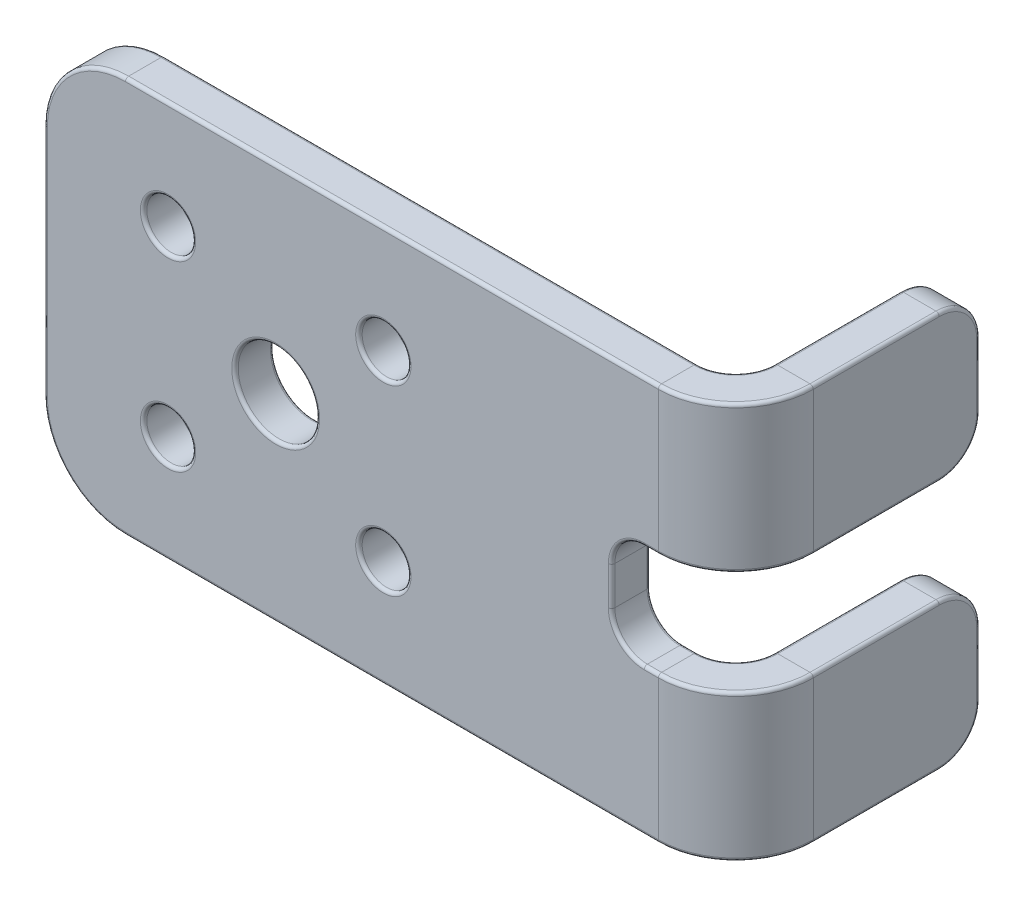
from build123d import *

# Parameters (mm, degrees)
BASE_FLANGE2_DEPTH             = 4.76
FILLET1_R                      = 4
FILLET2_R                      = 10
EDGE_FLANGE1_STRIP_W           = 28.56
EDGE_FLANGE1_STRIP_H           = 4.76
EDGE_FLANGE1_STRIP_CUT_DEPTH   = 18
EDGE_FLANGE1_STRIP_2_W         = 28.56
EDGE_FLANGE1_STRIP_2_H         = 4.76
EDGE_FLANGE1_STRIP_CUT_2_DEPTH = 18
EDGE_FLANGE1_DEPTH             = 18
EDGE_FLANGE1_BEND_DEPTH        = 18
FILLET3_R                      = 5
SKETCH16_R                     = 3
SKETCH16_R_2                   = 5
CUT_EXTRUDE2_DEPTH             = 10
FILLET4_R                      = 0.4
FILLET5_R                      = 0.4


# Sheet-metal steps are written as plain solids
with BuildPart() as part:
    # Sketch1 → Base-Flange2 (new body)
    with BuildSketch(Plane.XY):
        Polygon((27.240436749, 6.355), (42.5, 6.355), (42.5, 24.355), (-42.5, 24.355), (-42.5, -24.355), (42.5, -24.355), (42.5, -6.355), (27.240436749, -6.355), align=None)
    extrude(amount=-BASE_FLANGE2_DEPTH)

    # Fillet1
    fillet1_edges = [part.edges().sort_by_distance(p)[0] for p in [
        (27.240436749, 6.355, -2.38),
        (27.240436749, -6.355, -2.38),
    ]]
    fillet(fillet1_edges, radius=FILLET1_R)

    # Fillet2
    fillet2_edges = [part.edges().sort_by_distance(p)[0] for p in [
        (-42.5, -24.355, -2.38),
        (-42.5, 24.355, -2.38),
    ]]
    fillet(fillet2_edges, radius=FILLET2_R)

    # Edge-Flange1 strip (across the edge) → Edge-Flange1 strip cut (cut)
    with BuildSketch(Plane(origin=(42.5, 24.355, -4.76), x_dir=(-1, 0, 0), z_dir=(0, -1, 0))):
        with Locations((-4.76, -2.38)):
            Rectangle(EDGE_FLANGE1_STRIP_W, EDGE_FLANGE1_STRIP_H)
    extrude(amount=EDGE_FLANGE1_STRIP_CUT_DEPTH, mode=Mode.SUBTRACT)

    # Edge-Flange1 strip 2 (across the edge) → Edge-Flange1 strip cut 2 (cut)
    with BuildSketch(Plane(origin=(42.5, -6.355, -4.76), x_dir=(-1, 0, 0), z_dir=(0, -1, 0))):
        with Locations((-4.76, -2.38)):
            Rectangle(EDGE_FLANGE1_STRIP_2_W, EDGE_FLANGE1_STRIP_2_H)
    extrude(amount=EDGE_FLANGE1_STRIP_CUT_2_DEPTH, mode=Mode.SUBTRACT)

    # Edge-Flange1 section (across the edge) → Edge-Flange1 (add)
    with BuildSketch(Plane(origin=(42.5, 24.355, -4.76), x_dir=(-1, 0, 0), z_dir=(0, -1, 0))):
        with BuildLine():
            Line((0, 4.76), (0, 25.24))
            Line((0, 25.24), (4.76, 25.24))
            Line((4.76, 25.24), (4.76, 4.76))
            ThreePointArc((4.76, 4.76), (6.154171722, 1.394171722), (9.52, 0))
            Line((9.52, 0), (9.52, -4.76))
            ThreePointArc((9.52, -4.76), (2.788343443, -1.971656557), (0, 4.76))
        make_face()
    extrude(amount=EDGE_FLANGE1_DEPTH)

    # Edge-Flange1 section 2 (across the edge) → Edge-Flange1 bend (add)
    with BuildSketch(Plane(origin=(42.5, -6.355, -4.76), x_dir=(-1, 0, 0), z_dir=(0, -1, 0))):
        with BuildLine():
            Line((0, 4.76), (0, 25.24))
            Line((0, 25.24), (4.76, 25.24))
            Line((4.76, 25.24), (4.76, 4.76))
            ThreePointArc((4.76, 4.76), (6.154171722, 1.394171722), (9.52, 0))
            Line((9.52, 0), (9.52, -4.76))
            ThreePointArc((9.52, -4.76), (2.788343443, -1.971656557), (0, 4.76))
        make_face()
    extrude(amount=EDGE_FLANGE1_BEND_DEPTH)

    # Fillet3
    fillet3_edges = [part.edges().sort_by_distance(p)[0] for p in [
        (40.12, -6.355, -30),
        (40.12, -24.355, -30),
        (40.12, 24.355, -30),
        (40.12, 6.355, -30),
    ]]
    fillet(fillet3_edges, radius=FILLET3_R)

    # Sketch16 → Cut-Extrude2 (cut)
    with BuildSketch(Plane.XY):
        with BuildLine():
            Line((-27.27, 8.205), (-27.27, 11.205))
            Line((-27.27, 11.205), (-24.27, 11.205))
            ThreePointArc((-24.27, 11.205), (-29.391320344, 13.326320344), (-27.27, 8.205))
        make_face()
        with BuildLine():
            Line((-24.27, 11.205), (-27.27, 11.205))
            Line((-27.27, 11.205), (-27.27, 8.205))
            ThreePointArc((-27.27, 8.205), (-25.148679656, 9.083679656), (-24.27, 11.205))
        make_face()
        with Locations((-0.81, 11.205)):
            Circle(SKETCH16_R)
        with Locations((-0.81, -11.205)):
            Circle(SKETCH16_R)
        with Locations((-27.27, -11.205)):
            Circle(SKETCH16_R)
        with Locations((-14.04, 0)):
            Circle(SKETCH16_R_2)
    extrude(amount=-CUT_EXTRUDE2_DEPTH, mode=Mode.SUBTRACT)

    # Fillet4
    fillet4_edges = [part.edges().sort_by_distance(p)[0] for p in [
        (-19.04, 0, -4.76),
        (-19.04, 0, 0),
        (-30.27, -11.205, 0),
        (-30.27, -11.205, -4.76),
        (-3.81, -11.205, -4.76),
        (-3.81, -11.205, 0),
        (-3.81, 11.205, 0),
        (-3.81, 11.205, -4.76),
        (-27.27, 14.205, -4.76),
        (-27.27, 14.205, 0),
    ]]
    fillet(fillet4_edges, radius=FILLET4_R)

    # Fillet5
    fillet5_edges = [part.edges().sort_by_distance(p)[0] for p in [
        (39.711656557, -6.355, -2.788343443),
        (39.711656557, -24.355, -2.788343443),
        (36.345828278, -6.355, -6.154171722),
        (36.345828278, -24.355, -6.154171722),
        (37.74, -24.355, -17.26),
        (42.5, -24.355, -17.26),
        (37.74, -15.355, -30),
        (42.5, -15.355, -30),
        (37.74, -6.355, -17.26),
        (37.74, -7.819466094, -28.535533906),
        (37.74, -22.890533906, -28.535533906),
        (42.5, -6.355, -17.26),
        (42.5, -7.819466094, -28.535533906),
        (42.5, -22.890533906, -28.535533906),
        (37.74, 15.355, -30),
        (42.5, 15.355, -30),
        (37.74, 24.355, -17.26),
        (37.74, 22.890533906, -28.535533906),
        (37.74, 7.819466094, -28.535533906),
        (42.5, 24.355, -17.26),
        (42.5, 22.890533906, -28.535533906),
        (42.5, 7.819466094, -28.535533906),
        (27.240436749, 0, 0),
        (27.240436749, 0, -4.76),
        (32.110218374, 6.355, 0),
        (32.110218374, 6.355, -4.76),
        (28.412009624, -5.183427125, 0),
        (28.412009624, -5.183427125, -4.76),
        (28.412009624, 5.183427125, 0),
        (28.412009624, 5.183427125, -4.76),
        (-42.5, 0, 0),
        (-42.5, 0, -4.76),
        (0.24, -24.355, 0),
        (-39.571067812, 21.426067812, 0),
        (-39.571067812, -21.426067812, 0),
        (0.24, -24.355, -4.76),
        (-39.571067812, 21.426067812, -4.76),
        (-39.571067812, -21.426067812, -4.76),
        (0.24, 24.355, 0),
        (0.24, 24.355, -4.76),
        (32.110218374, -6.355, -4.76),
        (32.110218374, -6.355, 0),
        (39.711656557, 24.355, -2.788343443),
        (39.711656557, 6.355, -2.788343443),
        (36.345828278, 24.355, -6.154171722),
        (36.345828278, 6.355, -6.154171722),
        (37.74, 6.355, -17.26),
        (42.5, 6.355, -17.26),
    ]]
    fillet(fillet5_edges, radius=FILLET5_R)


solid = part.part
